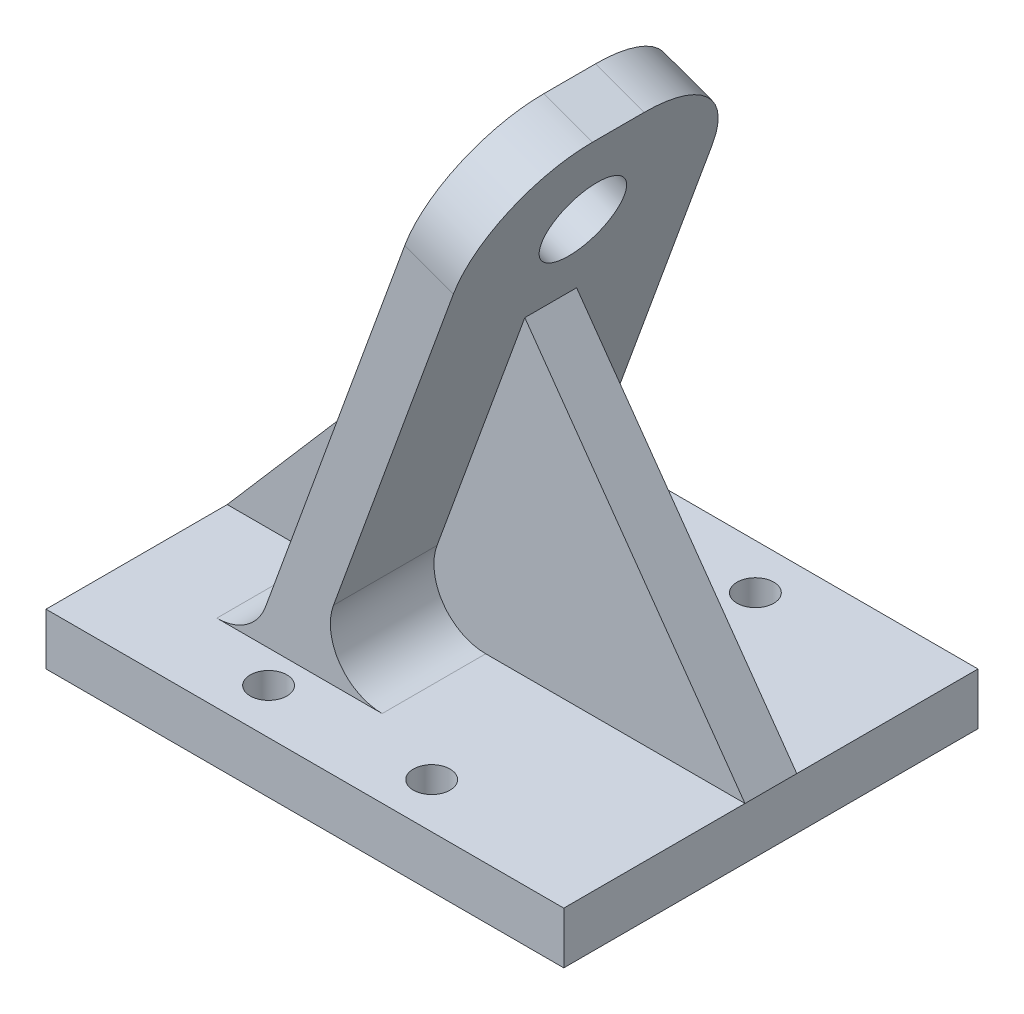
from build123d import *

# Parameters (mm, degrees)
SKETCH1_W           = 63.5
SKETCH1_H           = 50.8
BOSS_EXTRUDE1_DEPTH = 6.35
BOSS_EXTRUDE2_DEPTH = 15.875
FILLET1_R           = 12.7
FILLET2_R           = 6.35
BOSS_EXTRUDE5_DEPTH = 3.175
SKETCH5_R           = 5.08
CUT_EXTRUDE3_DEPTH  = 84.482225581
SKETCH8_R           = 2.25
CUT_EXTRUDE4_DEPTH  = 76.017772125


with BuildPart() as part:
    # Sketch1 → Boss-Extrude1 (new body)
    with BuildSketch(Plane(origin=(0, 0, 0), x_dir=(1, 0, 0), z_dir=(0, 1, 0))):
        Rectangle(SKETCH1_W, SKETCH1_H)
    extrude(amount=BOSS_EXTRUDE1_DEPTH)

    # Sketch2 → Boss-Extrude2 (add, symmetric)
    with BuildSketch(Plane.XY):
        Polygon((-11.43, 0), (13.036574415, 67.221360736), (7.069526273, 69.393188646), (-17.397048142, 2.17182791), align=None)
    extrude(amount=BOSS_EXTRUDE2_DEPTH, both=True)

    # Fillet1
    fillet1_edges = [part.edges().sort_by_distance(p)[0] for p in [
        (10.053050344, 68.307274691, 15.875),
        (10.053050344, 68.307274691, -15.875),
    ]]
    fillet(fillet1_edges, radius=FILLET1_R)

    # Fillet2
    fillet2_edges = [part.edges().sort_by_distance(p)[0] for p in [
        (-15.876317868, 6.35, 0),
        (-9.118789012, 6.35, 0),
    ]]
    fillet(fillet2_edges, radius=FILLET2_R)

    # Sketch7 → Boss-Extrude5 (add, symmetric)
    with BuildSketch(Plane.XY):
        with BuildLine():
            Line((4.748476913, 44.45), (31.75, 6.35))
            Line((31.75, 6.35), (-0.05004917, 6.35))
            ThreePointArc((-0.05004917, 6.35), (-5.251664651, 9.057789629), (-6.017097312, 14.87182791))
            Line((-6.017097312, 14.87182791), (4.748476913, 44.45))
        make_face()
        with BuildLine():
            Line((-31.75, 6.35), (-20.322635735, 6.35))
            ThreePointArc((-20.322635735, 6.35), (-16.680425364, 7.498384519), (-14.355587593, 10.52817209))
            Line((-14.355587593, 10.52817209), (-4.32026293, 38.1))
            Line((-4.32026293, 38.1), (-31.75, 6.35))
        make_face()
    extrude(amount=BOSS_EXTRUDE5_DEPTH, both=True)

    # Sketch5 → Cut-Extrude3 (cut, through all)
    with BuildSketch(Plane(origin=(-16.059992134, 5.845359099, 0), x_dir=(0, 0, 1), z_dir=(-0.9396926207859105, 0.34202014332566305, 0))):
        with Locations((0, 54.926187693)):
            Circle(SKETCH5_R)
    extrude(amount=-CUT_EXTRUDE3_DEPTH, mode=Mode.SUBTRACT)

    # Sketch8 → Cut-Extrude4 (cut, through all)
    with BuildSketch(Plane(origin=(0, 6.35, 0), x_dir=(1, 0, 0), z_dir=(0, 1, 0))):
        with Locations((10, -19.85)):
            Circle(SKETCH8_R)
        with Locations((10, 19.85)):
            Circle(SKETCH8_R)
        with Locations((-10, 19.85)):
            Circle(SKETCH8_R)
        with Locations((-10, -19.85)):
            Circle(SKETCH8_R)
    extrude(amount=-CUT_EXTRUDE4_DEPTH, mode=Mode.SUBTRACT)


solid = part.part
